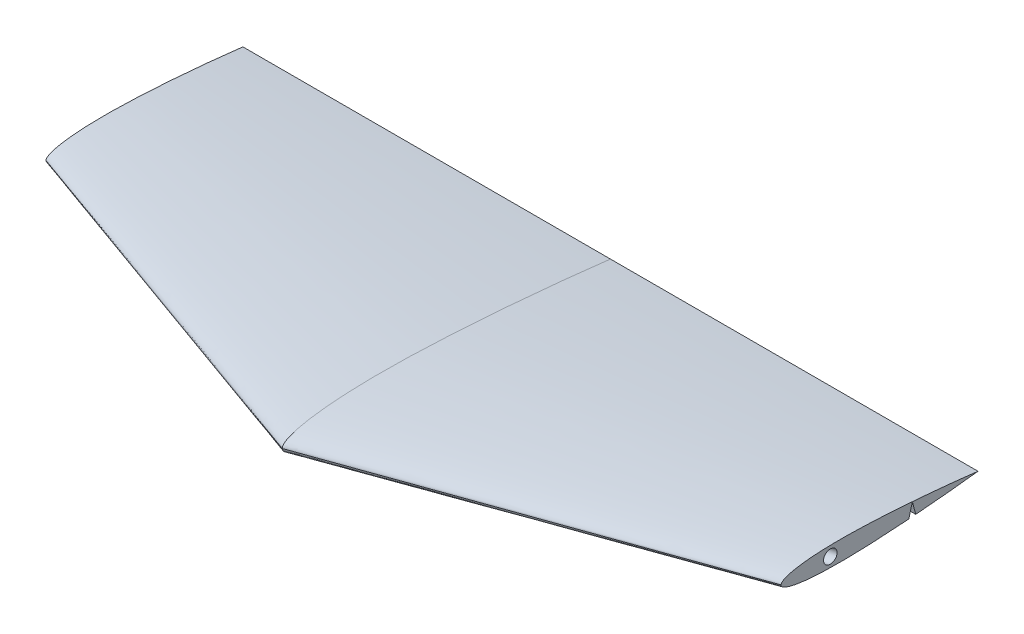
from build123d import *

# Parameters (mm, degrees)
CUT_EXTRUDE1_REACH             = 314.19
SKETCH10_R                     = 5
CUT_EXTRUDE1_DIRECTION_2_REACH = 314.19


with BuildPart() as part:
    # Sketch3 → Loft1 section 0
    with BuildSketch(Plane(origin=(0, 0, 0), x_dir=(0, 0, -1), z_dir=(1, 0, 0))):
        with BuildLine():
            add(Edge.make_bspline(
                [(-250, 0), (-249.999895281, 0.195763361), (-249.961151424, 0.603923402), (-249.75955923, 1.263250946), (-249.128153903, 2.239806839), (-248.109823795, 3.175235862), (-246.576102635, 4.182773144), (-244.127109162, 5.366692622), (-240.073872734, 6.817923154), (-232.840047676, 8.611288496), (-221.29446773, 10.449653683), (-205.80771311, 11.81775272), (-187.49226418, 12.532505163), (-167.615673922, 12.562370188), (-147.96130587, 12.104155942), (-127.983093335, 11.220881059), (-108.565528946, 10.107332464), (-88.272495474, 8.647865064), (-69.457807346, 7.164126414), (-48.249165687, 5.205040487), (-31.044142862, 3.54737405), (-13.203762803, 1.558807082), (-4.467222804, 0.541092362), (0, 0)],
                knots=[0, 0, 0, 0, 0, 0.0027914, 0.005882719, 0.009734657, 0.016522403, 0.022438151, 0.032158027, 0.04863424, 0.078248652, 0.129036717, 0.199997011, 0.270957307, 0.341917602, 0.412877898, 0.483838194, 0.554798491, 0.625758787, 0.696719083, 0.767679379, 0.838639675, 0.909599973, 0.909599973, 0.909599973, 0.909599973, 0.909599973], degree=4))
            add(Edge.make_bspline(
                [(-250, 0), (-249.999895281, -0.195763361), (-249.961151424, -0.603923402), (-249.75955923, -1.263250946), (-249.128153903, -2.239806839), (-248.109823795, -3.175235862), (-246.576102635, -4.182773144), (-244.127109162, -5.366692622), (-240.073872734, -6.817923154), (-232.840047676, -8.611288496), (-221.29446773, -10.449653683), (-205.80771311, -11.81775272), (-187.49226418, -12.532505163), (-167.615673922, -12.562370188), (-147.96130587, -12.104155942), (-127.983093335, -11.220881059), (-108.565528946, -10.107332464), (-88.272495474, -8.647865064), (-69.457807346, -7.164126414), (-48.249165687, -5.205040487), (-31.044142862, -3.54737405), (-13.203762803, -1.558807082), (-4.467222803, -0.541092362), (0, 0)],
                knots=[0, 0, 0, 0, 0, 0.0027914, 0.005882719, 0.009734657, 0.016522403, 0.022438151, 0.032158027, 0.04863424, 0.078248652, 0.129036717, 0.199997011, 0.270957307, 0.341917602, 0.412877898, 0.483838194, 0.554798491, 0.625758787, 0.696719083, 0.767679379, 0.838639675, 0.909599973, 0.909599973, 0.909599973, 0.909599973, 0.909599973], degree=4))
        make_face()
    # Sketch4 → Loft1 section 1
    with BuildSketch(Plane(origin=(280, 0, 0), x_dir=(0, 0, -1), z_dir=(1, 0, 0))):
        with BuildLine():
            add(Edge.make_bspline(
                [(-150, 0), (-149.999937168, 0.117458016), (-149.976690854, 0.362354041), (-149.855735538, 0.757950568), (-149.476892342, 1.343884103), (-148.865894277, 1.905141517), (-147.945661581, 2.509663886), (-146.476265497, 3.220015573), (-144.04432364, 4.090753893), (-139.704028605, 5.166773097), (-132.776680638, 6.26979221), (-123.484627866, 7.090651632), (-112.495358508, 7.519503098), (-100.569404353, 7.537422113), (-88.776783522, 7.262493565), (-76.789856001, 6.732528635), (-65.139317368, 6.064399479), (-52.963497284, 5.188719038), (-41.674684407, 4.298475849), (-28.949499412, 3.123024292), (-18.626485717, 2.12842443), (-7.922257682, 0.935284249), (-2.680333682, 0.324655417), (0, 0)],
                knots=[0, 0, 0, 0, 0, 0.0027914, 0.005882719, 0.009734657, 0.016522403, 0.022438151, 0.032158027, 0.04863424, 0.078248652, 0.129036717, 0.199997011, 0.270957307, 0.341917602, 0.412877898, 0.483838194, 0.554798491, 0.625758787, 0.696719083, 0.767679379, 0.838639675, 0.909599973, 0.909599973, 0.909599973, 0.909599973, 0.909599973], degree=4))
            add(Edge.make_bspline(
                [(-150, 0), (-149.999937169, -0.117458016), (-149.976690854, -0.362354041), (-149.855735538, -0.757950568), (-149.476892342, -1.343884103), (-148.865894277, -1.905141517), (-147.945661581, -2.509663886), (-146.476265497, -3.220015573), (-144.04432364, -4.090753893), (-139.704028605, -5.166773097), (-132.776680638, -6.26979221), (-123.484627866, -7.090651632), (-112.495358508, -7.519503098), (-100.569404353, -7.537422113), (-88.776783522, -7.262493565), (-76.789856001, -6.732528635), (-65.139317368, -6.064399479), (-52.963497285, -5.188719038), (-41.674684407, -4.298475849), (-28.949499412, -3.123024292), (-18.626485717, -2.12842443), (-7.922257682, -0.935284249), (-2.680333682, -0.324655417), (0, 0)],
                knots=[0, 0, 0, 0, 0, 0.0027914, 0.005882719, 0.009734657, 0.016522403, 0.022438151, 0.032158027, 0.04863424, 0.078248652, 0.129036717, 0.199997011, 0.270957307, 0.341917602, 0.412877898, 0.483838194, 0.554798491, 0.625758787, 0.696719083, 0.767679379, 0.838639675, 0.909599973, 0.909599973, 0.909599973, 0.909599973, 0.909599973], degree=4))
        make_face()
    loft1 = loft()

    # Sketch6 → Cut-Loft1 section 0
    with BuildSketch(Plane.ZY):
        with BuildLine():
            Line((50, 5.222578378), (52.906464275, -5.624493968))
            Line((52.906464275, -5.624493968), (53.308388064, -7.124493968))
            Line((53.308388064, -7.124493968), (46.691611936, -7.124493968))
            Line((46.691611936, -7.124493968), (47.236267419, -5.091812034))
            Line((47.236267419, -5.091812034), (50, 5.222578378))
        make_face()
    # Sketch7 → Cut-Loft1 section 1
    with BuildSketch(Plane(origin=(280, 0, 0), x_dir=(0, 0, -1), z_dir=(1, 0, 0))):
        with BuildLine():
            Line((-50, 4.868494183), (-47.424974841, -4.741630539))
            Line((-47.424974841, -4.741630539), (-46.913435499, -6.650721356))
            Line((-46.913435499, -6.650721356), (-53.086564501, -6.650721356))
            Line((-53.086564501, -6.650721356), (-52.684640712, -5.150721356))
            Line((-52.684640712, -5.150721356), (-50, 4.868494183))
        make_face()
    cut_loft1 = loft(mode=Mode.SUBTRACT)

    # Cut-Extrude1: up to this face of the body (flat: up to its plane)
    cut_extrude1_end = Plane(part.part.faces().sort_by_distance((280, 0.028717706, 87.957238567))[0])
    # Sketch10 → Cut-Extrude1 (cut, up to the picked face)
    with BuildSketch(Plane(origin=(280, 0, 112.499893994), x_dir=(0.2587358577450895, 0, 0.9659481124350898), z_dir=(-0.9659481124350898, 0, 0.2587358577450895)), mode=Mode.PRIVATE) as cut_extrude1_sk1:
        Circle(SKETCH10_R)
    cut_extrude1_tool1 = split(extrude(cut_extrude1_sk1.sketch, amount=-CUT_EXTRUDE1_REACH, mode=Mode.PRIVATE), bisect_by=cut_extrude1_end, keep=Keep.BOTH, mode=Mode.PRIVATE)
    cut_extrude1 = cut_extrude1_tool1.solids().sort_by(Axis((280, 0, 112.499894), (0.9659481124350898, 0, -0.2587358577450895)))[0]
    add(cut_extrude1, mode=Mode.SUBTRACT)

    # Cut-Extrude1 direction 2: up to this face of the body (flat: up to its plane)
    cut_extrude1_direction_2_end = Plane(part.part.faces().sort_by_distance((0, 0.013007435, 146.208249472))[0])
    # Sketch10 → Cut-Extrude1 direction 2 (cut, up to the picked face)
    with BuildSketch(Plane(origin=(280, 0, 112.499893994), x_dir=(0.2587358577450895, 0, 0.9659481124350898), z_dir=(-0.9659481124350898, 0, 0.2587358577450895)), mode=Mode.PRIVATE) as cut_extrude1_direction_2_sk1:
        Circle(SKETCH10_R)
    cut_extrude1_direction_2_tool1 = split(extrude(cut_extrude1_direction_2_sk1.sketch, amount=CUT_EXTRUDE1_DIRECTION_2_REACH, mode=Mode.PRIVATE), bisect_by=cut_extrude1_direction_2_end, keep=Keep.BOTH, mode=Mode.PRIVATE)
    cut_extrude1_direction_2 = cut_extrude1_direction_2_tool1.solids().sort_by(Axis((280, 0, 112.499894), (-0.9659481124350898, 0, 0.2587358577450895)))[0]
    add(cut_extrude1_direction_2, mode=Mode.SUBTRACT)

    # Mirror1: Loft1, Cut-Loft1, Cut-Extrude1, Cut-Extrude1 direction 2 across plane
    add(loft1.mirror(Plane(origin=(0, -11.080505768, 126.305662571), x_dir=(0, 0, 1), z_dir=(-1, 0, 0))))
    add(cut_loft1.mirror(Plane(origin=(0, -11.080505768, 126.305662571), x_dir=(0, 0, 1), z_dir=(-1, 0, 0))), mode=Mode.SUBTRACT)
    add(cut_extrude1.mirror(Plane(origin=(0, -11.080505768, 126.305662571), x_dir=(0, 0, 1), z_dir=(-1, 0, 0))), mode=Mode.SUBTRACT)
    add(cut_extrude1_direction_2.mirror(Plane(origin=(0, -11.080505768, 126.305662571), x_dir=(0, 0, 1), z_dir=(-1, 0, 0))), mode=Mode.SUBTRACT)


solid = part.part
